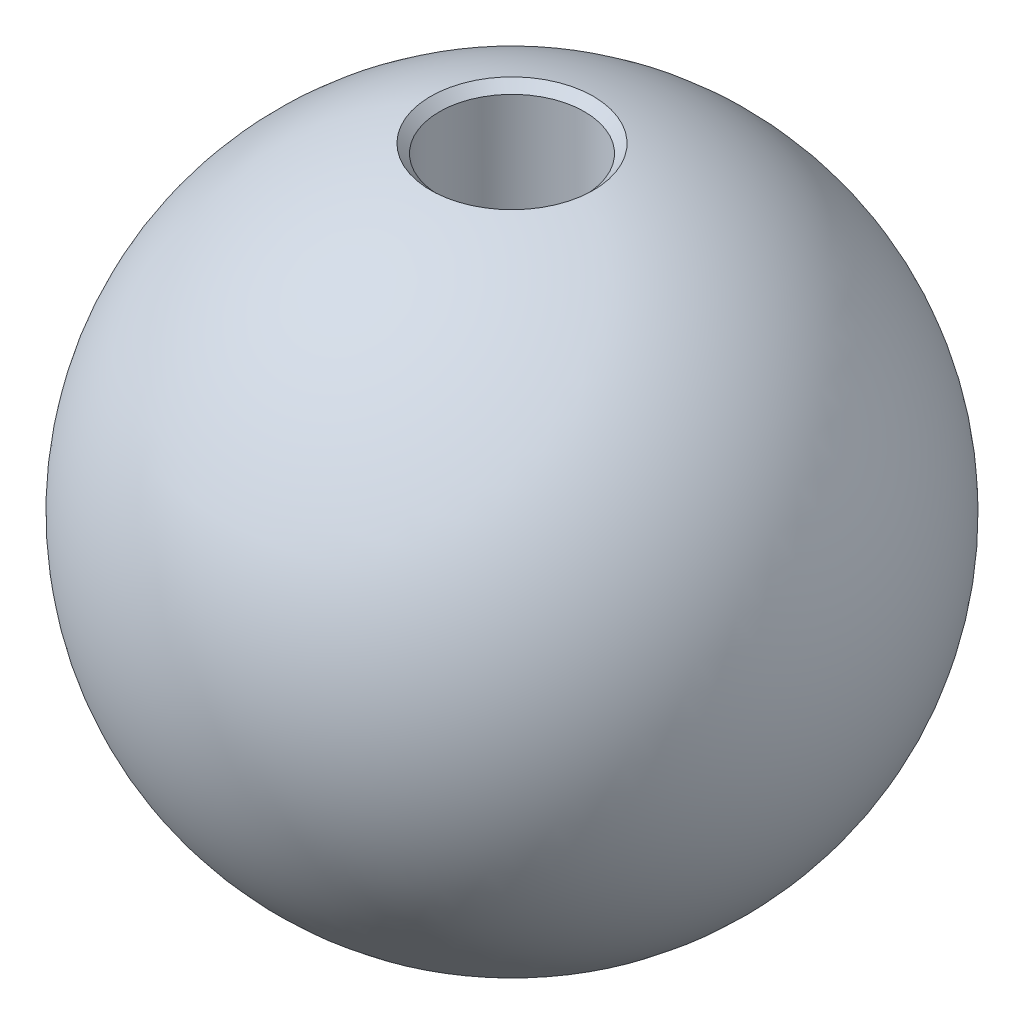
from build123d import *

# Parameters (mm, degrees)
TAP_DRILL_FOR_M4X0_7_TAP2_D     = 3.3
TAP_DRILL_FOR_M4X0_7_TAP2_DEPTH = 6
TAP_DRILL_FOR_M4X0_7_TAP2_TIP   = 0.991420021


with BuildPart() as part:
    # Sketch2 → Revolve1 (revolve)
    with BuildSketch(Plane.XY):
        with BuildLine():
            Line((-7.5, 0), (7.5, 0))
            ThreePointArc((7.5, 0), (0, 7.5), (-7.5, 0))
        make_face()
    revolve(axis=Axis((-7.5, 0, 0), (1, 0, 0)))

    # Tap Drill for M4x0.7 Tap2
    with Locations(Plane(origin=(0, 7.5, 0), x_dir=(1, 0, 0), z_dir=(0, 1, 0))):
        with Locations((0, 0)):
            Hole(TAP_DRILL_FOR_M4X0_7_TAP2_D / 2, depth=TAP_DRILL_FOR_M4X0_7_TAP2_DEPTH)
            with Locations((0, 0, -(TAP_DRILL_FOR_M4X0_7_TAP2_DEPTH + TAP_DRILL_FOR_M4X0_7_TAP2_TIP / 2))):  # 118° drill point
                Cone(0, TAP_DRILL_FOR_M4X0_7_TAP2_D / 2, TAP_DRILL_FOR_M4X0_7_TAP2_TIP, mode=Mode.SUBTRACT)

    # Chamfer1
    # the kernel refuses this chamfer: 0.25, 0.209117546 mm, written as the material it takes off along each edge
    with BuildSketch(Plane(origin=(-1e-09, 7.316249039, -3e-09), x_dir=(-1.0, 0, 1.5237922439259502e-09), z_dir=(1.5237922439259502e-09, 0, 1.0))) as chamfer1_piece_1:
        with BuildLine():
            Line((1.851597136, 0.048402863), (1.649999997, 0.250000002))
            Line((1.649999997, 0.250000002), (1.649999999, 0))
            ThreePointArc((1.649999999, 0), (1.75350475, 0.024114846), (1.851597136, 0.048402863))
        make_face()
    revolve(axis=Axis((-1e-09, 7.316249039, -3e-09), (0, -1, 0)), revolution_arc=180.000000175, mode=Mode.SUBTRACT)
    with BuildSketch(Plane(origin=(0, 7.316249039, 3e-09), x_dir=(1.0, 0, -1.755349969310666e-09), z_dir=(-1.755349969310666e-09, 0, -1.0))) as chamfer1_piece_2:
        with BuildLine():
            Line((1.851597137, 0.048402863), (1.649999997, 0.250000003))
            Line((1.649999997, 0.250000003), (1.65, 0))
            ThreePointArc((1.65, 0), (1.75350475, 0.024114847), (1.851597137, 0.048402863))
        make_face()
    revolve(axis=Axis((0, 7.316249039, 3e-09), (0, -1, 0)), revolution_arc=180.000000201, mode=Mode.SUBTRACT)


solid = part.part
